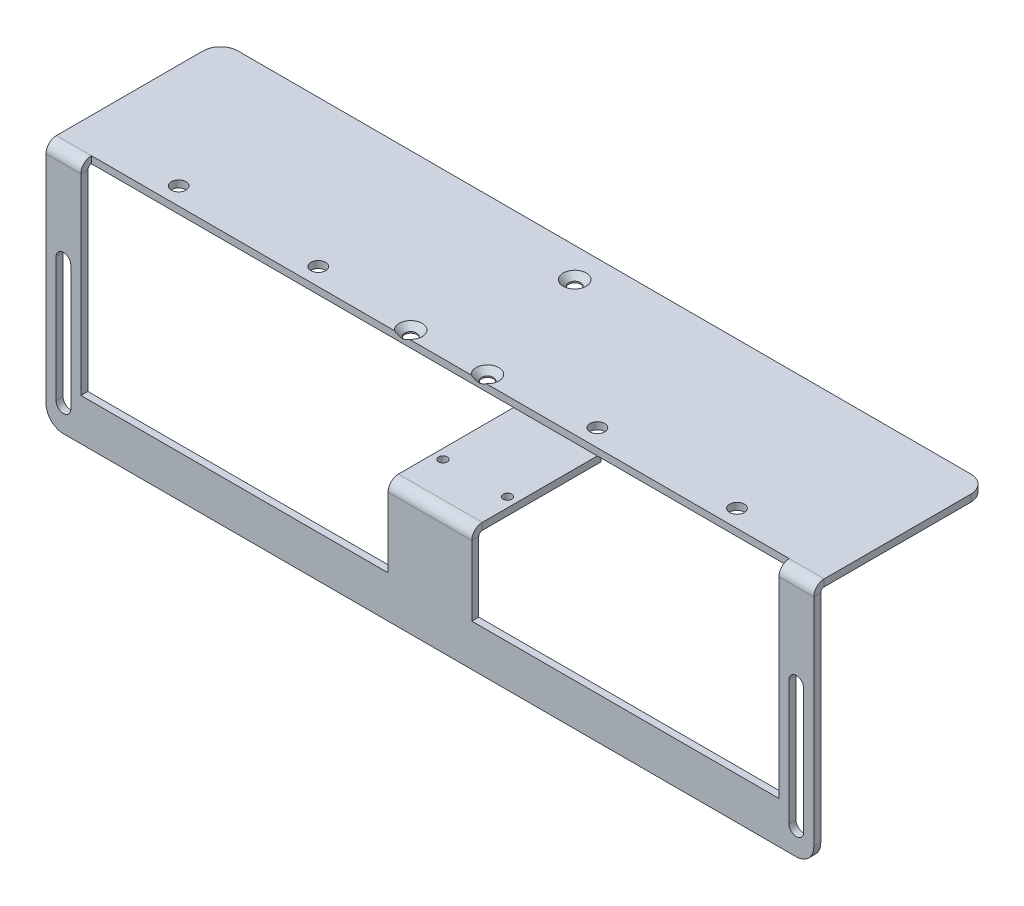
from build123d import *

# Parameters (mm, degrees)
SM_BASE_FLANGE_1_OUTLINE_W       = 220
SM_BASE_FLANGE_1_OUTLINE_H       = 2
SM_BASE_FLANGE_1_DEPTH           = 50
HOLE_WIZARD_1_AT_2_COUNT         = 2
HOLE_WIZARD_1_AT_2_PITCH         = 37.643060449
HOLE_WIZARD_1_AT_3_COUNT         = 2
HOLE_WIZARD_1_AT_3_PITCH         = 37.643060449
HOLE_WIZARD_4_2_4_2_1_D          = 4.2
SM_EDGE_FLANGE_1_STRIP_W         = 10
SM_EDGE_FLANGE_1_STRIP_H         = 2
SM_EDGE_FLANGE_1_STRIP_CUT_DEPTH = 220
SM_EDGE_FLANGE_1_DEPTH           = 220
SKETCH_16_W                      = 200
SKETCH_16_H                      = 58
CUT_EXTRUDE_1_DEPTH              = 3
SM_EDGE_FLANGE_2_DEPTH           = 24
HOLE_START                       = 48
HOLE_WIZARD_4_2_4_2_1_2_DEPTH    = 2
FILLET_1_R                       = 5
SKETCH_23_W                      = 1.25
SKETCH_23_H                      = 35
HOLE_WIZARD_M3_1_AT_2_COUNT      = 2
HOLE_WIZARD_M3_1_AT_2_PITCH      = 18.5


# Read off the part's stored shape, not the designer's step: 基体-法兰1, Ø4.2 (4.2) 直径槽口1
# Sheet-metal steps are written as plain solids
with BuildPart() as part:
    # 基体-法兰1 outline → 基体-法兰1 (new body)
    with BuildSketch(Plane.XY):
        with Locations((0, 24)):
            Rectangle(SM_BASE_FLANGE_1_OUTLINE_W, SM_BASE_FLANGE_1_OUTLINE_H)
    extrude(amount=SM_BASE_FLANGE_1_DEPTH)

    # 草图9 → 打孔尺寸(%根据)开槽沉头木螺钉的类型1 (revolve, cut)
    with BuildSketch(Plane(origin=(0, 25, 8.5), x_dir=(0, 0, 1), z_dir=(1, 0, 0))):
        Polygon((0, 0), (0, 2), (1.7, 2), (1.7, 1.6), (3.3, 0), align=None)
    hole_wizard_1 = revolve(axis=Axis((0, 31.35, 8.5), (0, -1, 0)), mode=Mode.SUBTRACT)

    # 打孔尺寸(%根据)开槽沉头木螺钉的类型1 at 2: 打孔尺寸(%根据)开槽沉头木螺钉的类型1 ×2
    with Locations(*[Vector(-0.2922185355990202, 0, 0.956351571051339) * (i * HOLE_WIZARD_1_AT_2_PITCH) for i in range(1, HOLE_WIZARD_1_AT_2_COUNT)]):
        add(hole_wizard_1, mode=Mode.SUBTRACT)

    # 打孔尺寸(%根据)开槽沉头木螺钉的类型1 at 3: 打孔尺寸(%根据)开槽沉头木螺钉的类型1 ×2
    with Locations(*[Vector(0.29221853559902033, 0, 0.956351571051339) * (i * HOLE_WIZARD_1_AT_3_PITCH) for i in range(1, HOLE_WIZARD_1_AT_3_COUNT)]):
        add(hole_wizard_1, mode=Mode.SUBTRACT)

    # Hole Wizard 4.2 _4.2_ _1 (through all)
    with Locations(Plane(origin=(0, 25, 0), x_dir=(1, 0, 0), z_dir=(0, 1, 0))):
        with Locations((-40, -42), (-80, -42), (40, -42), (80, -42)):
            Hole(HOLE_WIZARD_4_2_4_2_1_D / 2)

    # 边线-法兰1 strip (across the edge) → 边线-法兰1 strip cut (cut)
    with BuildSketch(Plane(origin=(110, 23, 50), x_dir=(0, 0, -1), z_dir=(-1, 0, 0))):
        with Locations((-2, -1)):
            Rectangle(SM_EDGE_FLANGE_1_STRIP_W, SM_EDGE_FLANGE_1_STRIP_H)
    extrude(amount=SM_EDGE_FLANGE_1_STRIP_CUT_DEPTH, mode=Mode.SUBTRACT)

    # 边线-法兰1 section (across the edge) → 边线-法兰1 (add)
    with BuildSketch(Plane(origin=(110, 23, 50), x_dir=(0, 0, -1), z_dir=(-1, 0, 0))):
        with BuildLine():
            Line((0, 1), (0, 68))
            Line((0, 68), (2, 68))
            Line((2, 68), (2, 1))
            ThreePointArc((2, 1), (2.292893219, 0.292893219), (3, 0))
            Line((3, 0), (3, -2))
            ThreePointArc((3, -2), (0.878679656, -1.121320344), (0, 1))
        make_face()
    extrude(amount=SM_EDGE_FLANGE_1_DEPTH)

    # 草图16 → 切除-拉伸1 (cut)
    with BuildSketch(Plane.XY.offset(50)):
        with Locations((0, -4)):
            Rectangle(SKETCH_16_W, SKETCH_16_H)
    extrude(amount=-CUT_EXTRUDE_1_DEPTH, mode=Mode.SUBTRACT)

    # 边线-法兰2 section (across the edge) → 边线-法兰2 (add)
    with BuildSketch(Plane(origin=(-12, -10, 48), x_dir=(0, -1, 0), z_dir=(1, 0, 0))):
        with BuildLine():
            Line((0, 1), (0, 35))
            Line((0, 35), (2, 35))
            Line((2, 35), (2, 1))
            ThreePointArc((2, 1), (2.292893219, 0.292893219), (3, 0))
            Line((3, 0), (23, 0))
            Line((23, 0), (23, -2))
            Line((23, -2), (3, -2))
            ThreePointArc((3, -2), (0.878679656, -1.121320344), (0, 1))
        make_face()
    extrude(amount=SM_EDGE_FLANGE_2_DEPTH)

    # Hole Wizard 4.2 _4.2_ _1 2 outline → Hole Wizard 4.2 _4.2_ _1 2 (cut)
    with BuildSketch(Plane.XY.offset(HOLE_START)):
        with BuildLine():
            ThreePointArc((107.1, -2.1), (105, 0), (102.9, -2.1))
            Line((102.9, -2.1), (102.9, -37.9))
            ThreePointArc((102.9, -37.9), (105, -40), (107.1, -37.9))
            Line((107.1, -37.9), (107.1, -2.1))
        make_face()
        with BuildLine():
            Line((-102.9, -37.9), (-102.9, -2.1))
            ThreePointArc((-102.9, -2.1), (-105, 0), (-107.1, -2.1))
            Line((-107.1, -2.1), (-107.1, -37.9))
            ThreePointArc((-107.1, -37.9), (-105, -40), (-102.9, -37.9))
        make_face()
    extrude(amount=HOLE_WIZARD_4_2_4_2_1_2_DEPTH, mode=Mode.SUBTRACT)

    # 圆角1
    fillet_1_edges = [part.edges().sort_by_distance(p)[0] for p in [
        (-110, 24, 0),
        (110, 24, 0),
        (110, -45, 49),
        (-110, -45, 49),
    ]]
    fillet(fillet_1_edges, radius=FILLET_1_R)

    # 草图23 → M3 螺纹孔1 (revolve, cut)
    with BuildSketch(Plane(origin=(9.25, -10, 37), x_dir=(0, 0, 1), z_dir=(1, 0, 0))):
        with Locations((0.625, 17.5)):
            Rectangle(SKETCH_23_W, SKETCH_23_H)
    hole_wizard_m3_1 = revolve(axis=Axis((9.25, -3.65, 37), (0, -1, 0)), mode=Mode.SUBTRACT)

    # M3 螺纹孔1 at 2: M3 螺纹孔1 ×2
    with Locations(*[(-i * HOLE_WIZARD_M3_1_AT_2_PITCH, 0, 0) for i in range(1, HOLE_WIZARD_M3_1_AT_2_COUNT)]):
        add(hole_wizard_m3_1, mode=Mode.SUBTRACT)


solid = part.part
